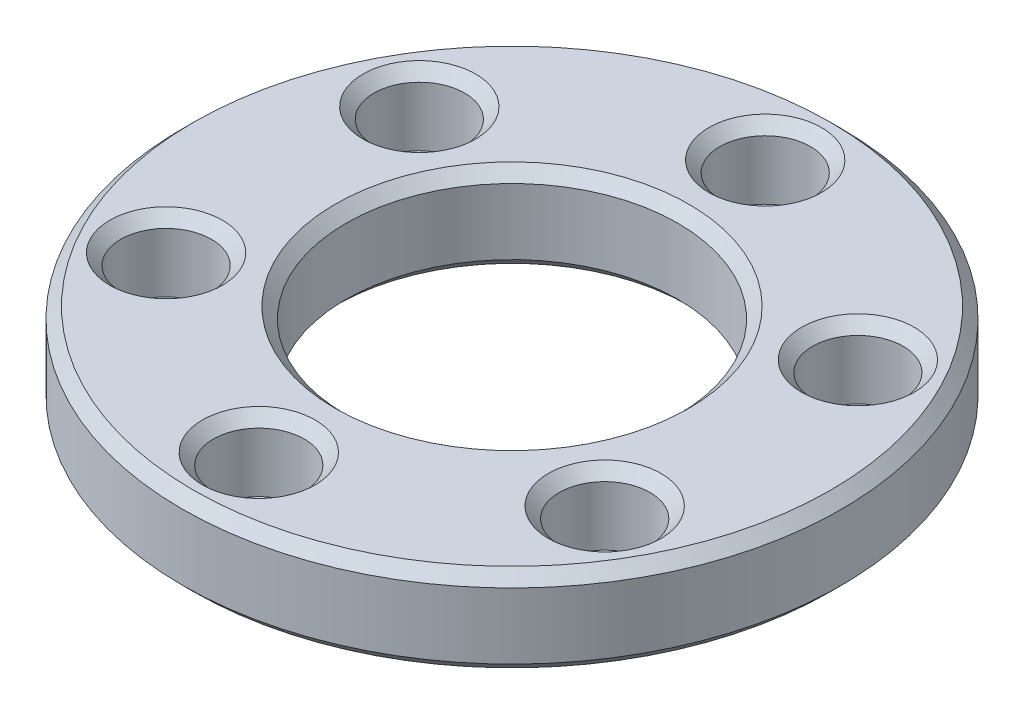
from build123d import *

# Parameters (mm, degrees)
SKETCH_1_R      = 15
SKETCH_1_R_2    = 7.55
SKETCH_1_R_3    = 2.065
EXTRUDE_1_DEPTH = 3.2
EXTRUDE_START   = 0.8
SKETCH_2_R      = 15
SKETCH_2_R_2    = 7.55
SKETCH_2_R_3    = 0.9
EXTRUDE_2_DEPTH = 0.8
CHAMFER_1_SIZE  = 0.5


with BuildPart() as part:
    # 草图1 → 凸台-拉伸1 (new body)
    with BuildSketch(Plane(origin=(0, 0, 0), x_dir=(1, 0, 0), z_dir=(0, 1, 0))):
        Circle(SKETCH_1_R)
        Circle(SKETCH_1_R_2, mode=Mode.SUBTRACT)
        with Locations((0, 11.525)):
            Circle(SKETCH_1_R_3, mode=Mode.SUBTRACT)
        with Locations((9.980942779, 5.7625)):
            Circle(SKETCH_1_R_3, mode=Mode.SUBTRACT)
        with Locations((9.980942779, -5.7625)):
            Circle(SKETCH_1_R_3, mode=Mode.SUBTRACT)
        with Locations((0, -11.525)):
            Circle(SKETCH_1_R_3, mode=Mode.SUBTRACT)
        with Locations((-9.980942779, -5.7625)):
            Circle(SKETCH_1_R_3, mode=Mode.SUBTRACT)
        with Locations((-9.980942779, 5.7625)):
            Circle(SKETCH_1_R_3, mode=Mode.SUBTRACT)
    extrude(amount=EXTRUDE_1_DEPTH)

    # 草图2 → 凸台-拉伸2 (add)
    with BuildSketch(Plane(origin=(0, 0, 0), x_dir=(-1, 0, 0), z_dir=(0, -1, 0)).offset(EXTRUDE_START)):
        Circle(SKETCH_2_R)
        Circle(SKETCH_2_R_2, mode=Mode.SUBTRACT)
        with Locations((0, 11.53)):
            Circle(SKETCH_2_R_3, mode=Mode.SUBTRACT)
        with Locations((9.985272906, 5.765)):
            Circle(SKETCH_2_R_3, mode=Mode.SUBTRACT)
        with Locations((9.985272906, -5.765)):
            Circle(SKETCH_2_R_3, mode=Mode.SUBTRACT)
        with Locations((0, -11.53)):
            Circle(SKETCH_2_R_3, mode=Mode.SUBTRACT)
        with Locations((-9.985272906, -5.765)):
            Circle(SKETCH_2_R_3, mode=Mode.SUBTRACT)
        with Locations((-9.985272906, 5.765)):
            Circle(SKETCH_2_R_3, mode=Mode.SUBTRACT)
    extrude(amount=-EXTRUDE_2_DEPTH)

    # 倒角1
    chamfer_1_edges = [part.edges().sort_by_distance(p)[0] for p in [
        (7.55, -0.8, 0),
        (15, -0.8, 0),
        (-12.045942779, 3.2, -5.7625),
        (-2.065, 3.2, 11.525),
        (7.915942779, 3.2, -5.7625),
        (-7.55, 3.2, 0),
        (-15, 3.2, 0),
        (-2.065, 3.2, -11.525),
        (7.915942779, 3.2, 5.7625),
        (-12.045942779, 3.2, 5.7625),
    ]]
    chamfer(chamfer_1_edges, length=CHAMFER_1_SIZE)


solid = part.part
